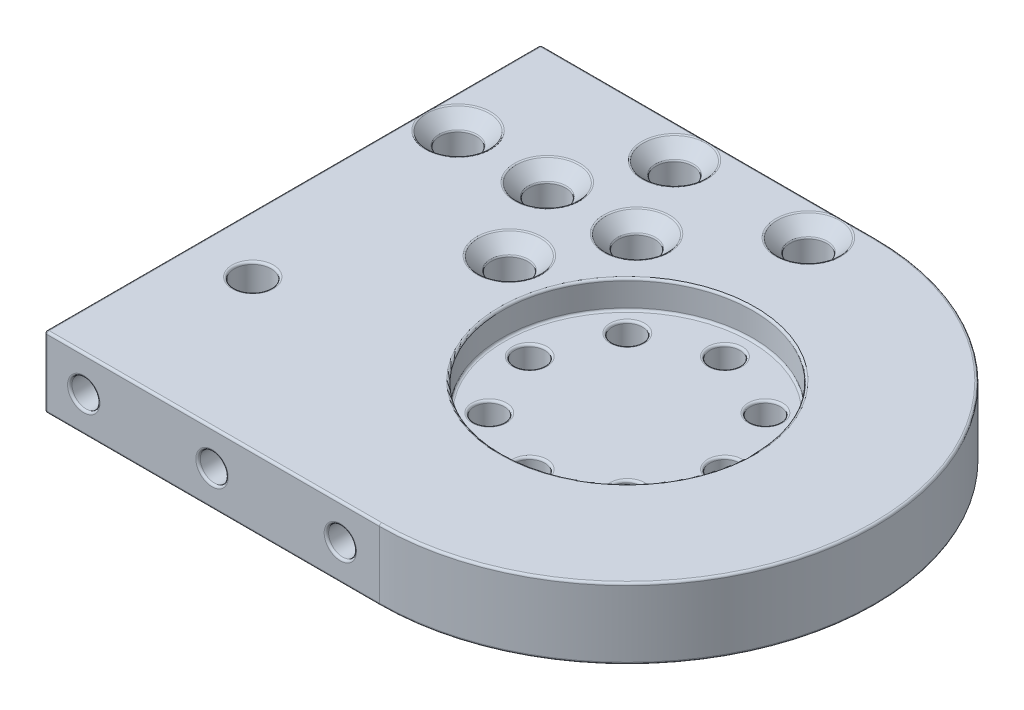
from build123d import *

# Parameters (mm, degrees)
SKETCH1_R           = 3.3
SKETCH1_R_2         = 22.5
SKETCH1_R_3         = 2.7
BOSS_EXTRUDE1_DEPTH = 12.7
CHAMFER2_SIZE       = 2.4
SKETCH1_3_R         = 22.5
CUT_EXTRUDE1_DEPTH  = 5
SKETCH2_R           = 2.5
CUT_EXTRUDE2_DEPTH  = 10
FILLET1_R           = 0.4


with BuildPart() as part:
    # Sketch1 → Boss-Extrude1 (new body)
    # profile 1 of 2: a face of its own
    with BuildSketch(Plane(origin=(0, 0, 0), x_dir=(1, 0, 0), z_dir=(0, 1, 0))):
        with BuildLine():
            Line((-60, -44.45), (0, -44.45))
            ThreePointArc((0, -44.45), (44.45, 0), (0, 44.45))
            Line((0, 44.45), (-60, 44.45))
            Line((-60, 44.45), (-60, -44.45))
        make_face()
        with Locations(Location((-49.69, -17.46, 0), (0, 0, 270))):
            Circle(SKETCH1_R, mode=Mode.SUBTRACT)
        with Locations(Location((-54, 23.65, 0), (0, 0, 270))):
            Circle(SKETCH1_R, mode=Mode.SUBTRACT)
        with Locations(Location((-6, 38.45, 0), (0, 0, 270))):
            Circle(SKETCH1_R, mode=Mode.SUBTRACT)
        with Locations(Location((-38, 23.65, 0), (0, 0, 270))):
            Circle(SKETCH1_R, mode=Mode.SUBTRACT)
        with Locations(Location((-22, 23.65, 0), (0, 0, 270))):
            Circle(SKETCH1_R, mode=Mode.SUBTRACT)
        with Locations(Location((-30, 8.85, 0), (0, 0, 270))):
            Circle(SKETCH1_R, mode=Mode.SUBTRACT)
        with Locations(Location((-30, 38.45, 0), (0, 0, 270))):
            Circle(SKETCH1_R, mode=Mode.SUBTRACT)
        Circle(SKETCH1_R_2, mode=Mode.SUBTRACT)
    # profile 2 of 2: a face of its own
    with BuildSketch(Plane(origin=(0, 0, 0), x_dir=(1, 0, 0), z_dir=(0, 1, 0))):
        Circle(SKETCH1_R_2)
        with Locations(Location((17.5, 0, 0), (0, 0, 270))):
            Circle(SKETCH1_R_3, mode=Mode.SUBTRACT)
        with Locations(Location((12.374368671, -12.374368671, 0), (0, 0, 270))):
            Circle(SKETCH1_R_3, mode=Mode.SUBTRACT)
        with Locations(Location((0, -17.5, 0), (0, 0, 270))):
            Circle(SKETCH1_R_3, mode=Mode.SUBTRACT)
        with Locations(Location((-12.374368671, -12.374368671, 0), (0, 0, 270))):
            Circle(SKETCH1_R_3, mode=Mode.SUBTRACT)
        with Locations(Location((-17.5, 0, 0), (0, 0, 270))):
            Circle(SKETCH1_R_3, mode=Mode.SUBTRACT)
        with Locations(Location((-12.374368671, 12.374368671, 0), (0, 0, 270))):
            Circle(SKETCH1_R_3, mode=Mode.SUBTRACT)
        with Locations(Location((0, 17.5, 0), (0, 0, 270))):
            Circle(SKETCH1_R_3, mode=Mode.SUBTRACT)
        with Locations(Location((12.374368671, 12.374368671, 0), (0, 0, 270))):
            Circle(SKETCH1_R_3, mode=Mode.SUBTRACT)
    extrude(amount=-BOSS_EXTRUDE1_DEPTH)

    # Chamfer2
    chamfer2_edges = [part.edges().sort_by_distance(p)[0] for p in [
        (-30, 0, -41.75),
        (-30, 0, -12.15),
        (-22, 0, -26.95),
        (-38, 0, -26.95),
        (-6, 0, -41.75),
        (-54, 0, -26.95),
    ]]
    chamfer(chamfer2_edges, length=CHAMFER2_SIZE)

    # Sketch1<3> → Cut-Extrude1 (cut)
    with BuildSketch(Plane(origin=(0, 0, 0), x_dir=(1, 0, 0), z_dir=(0, 1, 0))):
        with Locations(Location((0, 0, 0), (0, 0, 270))):
            Circle(SKETCH1_3_R)
    extrude(amount=-CUT_EXTRUDE1_DEPTH, mode=Mode.SUBTRACT)

    # Sketch2 → Cut-Extrude2 (cut)
    with BuildSketch(Plane.XY.offset(44.45)):
        with Locations((-7, -6.35)):
            Circle(SKETCH2_R)
        with Locations((-30, -6.35)):
            Circle(SKETCH2_R)
        with Locations((-53, -6.35)):
            Circle(SKETCH2_R)
    extrude(amount=-CUT_EXTRUDE2_DEPTH, mode=Mode.SUBTRACT)

    # Fillet1
    # the kernel refuses this fillet: 0.4 mm, written as the material it adds along each edge
    with BuildSketch(Plane(origin=(-7, -6.35, 34.45), x_dir=(1, 0, 0), z_dir=(0, -1, 0))) as fillet1_piece_1:
        with BuildLine():
            CenterArc((2.5 - FILLET1_R, FILLET1_R), FILLET1_R, 270, 90)
            Line((2.5 - FILLET1_R, 0), (2.5, 0))
            Line((2.5, 0), (2.5, FILLET1_R))
        make_face()
    revolve(axis=Axis((-7, -6.35, 34.45), (0, 0, 1)))
    with BuildSketch(Plane(origin=(-30, -6.35, 34.45), x_dir=(1, 0, 0), z_dir=(0, -1, 0))) as fillet1_piece_2:
        with BuildLine():
            CenterArc((2.5 - FILLET1_R, FILLET1_R), FILLET1_R, 270, 90)
            Line((2.5 - FILLET1_R, 0), (2.5, 0))
            Line((2.5, 0), (2.5, FILLET1_R))
        make_face()
    revolve(axis=Axis((-30, -6.35, 34.45), (0, 0, 1)))
    with BuildSketch(Plane(origin=(-53, -6.35, 34.45), x_dir=(1, 0, 0), z_dir=(0, -1, 0))) as fillet1_piece_3:
        with BuildLine():
            CenterArc((2.5 - FILLET1_R, FILLET1_R), FILLET1_R, 270, 90)
            Line((2.5 - FILLET1_R, 0), (2.5, 0))
            Line((2.5, 0), (2.5, FILLET1_R))
        make_face()
    revolve(axis=Axis((-53, -6.35, 34.45), (0, 0, 1)))
    with BuildSketch(Plane(origin=(0, -5, 0), x_dir=(0, 0, 1), z_dir=(-1, 0, 0))) as fillet1_piece_4:
        with BuildLine():
            CenterArc((22.5 - FILLET1_R, FILLET1_R), FILLET1_R, 270, 90)
            Line((22.5 - FILLET1_R, 0), (22.5, 0))
            Line((22.5, 0), (22.5, FILLET1_R))
        make_face()
    revolve(axis=Axis((0, -5, 0), (0, 1, 0)))
    # the kernel refuses this fillet: 0.4 mm, written as the material it takes off along each edge
    with BuildSketch(Plane(origin=(-59.6, -0.4, -44.05), x_dir=(0, 0, -1), z_dir=(0, 1, 0))) as fillet1_2_piece_1_section:
        Polygon((0, 0), (FILLET1_R, 0), (FILLET1_R, FILLET1_R), (0, FILLET1_R), align=None)
    fillet1_2_piece_1 = extrude(amount=FILLET1_R, mode=Mode.PRIVATE)
    fillet1_2_piece_1 = fillet1_2_piece_1 - Plane(origin=(-59.6, -0.4, -44.05), x_dir=(0.7071067811865475, 0, 0.7071067811865475), z_dir=(0, 1, 0)) * Sphere(FILLET1_R, mode=Mode.PRIVATE)
    add(fillet1_2_piece_1, mode=Mode.SUBTRACT)
    with BuildSketch(Plane(origin=(-59.6, -0.4, 44.05), x_dir=(-1, 0, 0), z_dir=(0, 1, 0))) as fillet1_2_piece_2_section:
        Polygon((0, 0), (FILLET1_R, 0), (FILLET1_R, FILLET1_R), (0, FILLET1_R), align=None)
    fillet1_2_piece_2 = extrude(amount=FILLET1_R, mode=Mode.PRIVATE)
    fillet1_2_piece_2 = fillet1_2_piece_2 - Plane(origin=(-59.6, -0.4, 44.05), x_dir=(0.7071067811865475, 0, -0.7071067811865475), z_dir=(0, 1, 0)) * Sphere(FILLET1_R, mode=Mode.PRIVATE)
    add(fillet1_2_piece_2, mode=Mode.SUBTRACT)
    with BuildSketch(Plane(origin=(-59.6, -12.3, 44.05), x_dir=(0, 0, 1), z_dir=(-1, 0, 0))) as fillet1_2_piece_3_section:
        Polygon((0, 0), (FILLET1_R, 0), (FILLET1_R, -FILLET1_R), (0, -FILLET1_R), align=None)
    fillet1_2_piece_3 = extrude(amount=FILLET1_R, mode=Mode.PRIVATE)
    fillet1_2_piece_3 = fillet1_2_piece_3 - Plane(origin=(-59.6, -12.3, 44.05), x_dir=(0, 0.7071067811865475, -0.7071067811865475), z_dir=(-1, 0, 0)) * Sphere(FILLET1_R, mode=Mode.PRIVATE)
    add(fillet1_2_piece_3, mode=Mode.SUBTRACT)
    with BuildSketch(Plane(origin=(-59.6, -12.3, -44.05), x_dir=(-1, 0, 0), z_dir=(0, 0, -1))) as fillet1_2_piece_4_section:
        Polygon((0, 0), (FILLET1_R, 0), (FILLET1_R, -FILLET1_R), (0, -FILLET1_R), align=None)
    fillet1_2_piece_4 = extrude(amount=FILLET1_R, mode=Mode.PRIVATE)
    fillet1_2_piece_4 = fillet1_2_piece_4 - Plane(origin=(-59.6, -12.3, -44.05), x_dir=(0.7071067811865475, 0.7071067811865475, 0), z_dir=(0, 0, -1)) * Sphere(FILLET1_R, mode=Mode.PRIVATE)
    add(fillet1_2_piece_4, mode=Mode.SUBTRACT)
    with BuildSketch(Plane(origin=(-7, -6.35, 44.45), x_dir=(1, 0, 0), z_dir=(0, -1, 0))) as fillet1_2_piece_5:
        with BuildLine():
            CenterArc((2.5 + FILLET1_R, -FILLET1_R), FILLET1_R, 90, 90)
            Line((2.5, -FILLET1_R), (2.5, 0))
            Line((2.5, 0), (2.5 + FILLET1_R, 0))
        make_face()
    revolve(axis=Axis((-7, -6.35, 44.45), (0, 0, 1)), mode=Mode.SUBTRACT)
    with BuildSketch(Plane(origin=(-30, -6.35, 44.45), x_dir=(1, 0, 0), z_dir=(0, -1, 0))) as fillet1_2_piece_6:
        with BuildLine():
            CenterArc((2.5 + FILLET1_R, -FILLET1_R), FILLET1_R, 90, 90)
            Line((2.5, -FILLET1_R), (2.5, 0))
            Line((2.5, 0), (2.5 + FILLET1_R, 0))
        make_face()
    revolve(axis=Axis((-30, -6.35, 44.45), (0, 0, 1)), mode=Mode.SUBTRACT)
    with BuildSketch(Plane(origin=(-53, -6.35, 44.45), x_dir=(1, 0, 0), z_dir=(0, -1, 0))) as fillet1_2_piece_7:
        with BuildLine():
            CenterArc((2.5 + FILLET1_R, -FILLET1_R), FILLET1_R, 90, 90)
            Line((2.5, -FILLET1_R), (2.5, 0))
            Line((2.5, 0), (2.5 + FILLET1_R, 0))
        make_face()
    revolve(axis=Axis((-53, -6.35, 44.45), (0, 0, 1)), mode=Mode.SUBTRACT)
    with BuildSketch(Plane(origin=(-49.69, -12.7, 17.46), x_dir=(0, 0, 1), z_dir=(-1, 0, 0))) as fillet1_2_piece_8:
        with BuildLine():
            CenterArc((3.3 + FILLET1_R, FILLET1_R), FILLET1_R, 180, 90)
            Line((3.3 + FILLET1_R, 0), (3.3, 0))
            Line((3.3, 0), (3.3, FILLET1_R))
        make_face()
    revolve(axis=Axis((-49.69, -12.7, 17.46), (0, 1, 0)), mode=Mode.SUBTRACT)
    with BuildSketch(Plane(origin=(-54, -12.7, -23.65), x_dir=(0, 0, 1), z_dir=(-1, 0, 0))) as fillet1_2_piece_9:
        with BuildLine():
            CenterArc((3.3 + FILLET1_R, FILLET1_R), FILLET1_R, 180, 90)
            Line((3.3, FILLET1_R), (3.3, 0))
            Line((3.3, 0), (3.3 + FILLET1_R, 0))
        make_face()
    revolve(axis=Axis((-54, -12.7, -23.65), (0, 1, 0)), mode=Mode.SUBTRACT)
    with BuildSketch(Plane(origin=(-60, 0, -44.05), x_dir=(1, 0, 0), z_dir=(0, 0, 1)), Plane(origin=(-60, -12.7, -44.05), x_dir=(0, 1, 0), z_dir=(0, 0, 1))) as fillet1_2_piece_10:
        with BuildLine():
            CenterArc((FILLET1_R, -FILLET1_R), FILLET1_R, 90, 90)
            Line((0, -FILLET1_R), (0, 0))
            Line((0, 0), (FILLET1_R, 0))
        make_face()
    extrude(amount=88.1, mode=Mode.SUBTRACT)
    with BuildSketch(Plane(origin=(0, 0, -44.45), x_dir=(0, 0, 1), z_dir=(-1, 0, 0)), Plane(origin=(-59.6, 0, 44.45), x_dir=(0, 0, -1), z_dir=(1, 0, 0)), Plane(origin=(-59.6, -12.7, 44.45), x_dir=(0, 1, 0), z_dir=(1, 0, 0)), Plane(origin=(0, -12.7, -44.45), x_dir=(0, 1, 0), z_dir=(-1, 0, 0))) as fillet1_2_piece_11:
        with BuildLine():
            CenterArc((FILLET1_R, -FILLET1_R), FILLET1_R, 90, 90)
            Line((0, -FILLET1_R), (0, 0))
            Line((0, 0), (FILLET1_R, 0))
        make_face()
    extrude(amount=59.6, mode=Mode.SUBTRACT)
    with BuildSketch(Plane(origin=(0, 0, 0), x_dir=(0, 0, 1), z_dir=(-1, 0, 0))) as fillet1_2_piece_12:
        with BuildLine():
            CenterArc((44.45 - FILLET1_R, -FILLET1_R), FILLET1_R, 0, 90)
            Line((44.45, -FILLET1_R), (44.45, 0))
            Line((44.45, 0), (44.45 - FILLET1_R, 0))
        make_face()
    revolve(axis=Axis((0, 0, 0), (0, 1, 0)), revolution_arc=180, mode=Mode.SUBTRACT)
    with BuildSketch(Plane(origin=(-6, -12.7, -38.45), x_dir=(0, 0, 1), z_dir=(-1, 0, 0))) as fillet1_2_piece_13:
        with BuildLine():
            CenterArc((3.3 + FILLET1_R, FILLET1_R), FILLET1_R, 180, 90)
            Line((3.3, FILLET1_R), (3.3, 0))
            Line((3.3, 0), (3.3 + FILLET1_R, 0))
        make_face()
    revolve(axis=Axis((-6, -12.7, -38.45), (0, 1, 0)), mode=Mode.SUBTRACT)
    with BuildSketch(Plane(origin=(-49.69, 0, 17.46), x_dir=(0, 0, 1), z_dir=(-1, 0, 0))) as fillet1_2_piece_14:
        with BuildLine():
            CenterArc((3.3 + FILLET1_R, -FILLET1_R), FILLET1_R, 90, 90)
            Line((3.3, -FILLET1_R), (3.3, 0))
            Line((3.3, 0), (3.3 + FILLET1_R, 0))
        make_face()
    revolve(axis=Axis((-49.69, 0, 17.46), (0, 1, 0)), mode=Mode.SUBTRACT)
    with BuildSketch(Plane(origin=(-38, -12.7, -23.65), x_dir=(0, 0, 1), z_dir=(-1, 0, 0))) as fillet1_2_piece_15:
        with BuildLine():
            CenterArc((3.3 + FILLET1_R, FILLET1_R), FILLET1_R, 180, 90)
            Line((3.3, FILLET1_R), (3.3, 0))
            Line((3.3, 0), (3.3 + FILLET1_R, 0))
        make_face()
    revolve(axis=Axis((-38, -12.7, -23.65), (0, 1, 0)), mode=Mode.SUBTRACT)
    with BuildSketch(Plane(origin=(-60, -0.4, 44.45), x_dir=(0, 0, -1), z_dir=(0, -1, 0)), Plane(origin=(-60, -0.4, -44.45), x_dir=(1, 0, 0), z_dir=(0, -1, 0))) as fillet1_2_piece_16:
        with BuildLine():
            CenterArc((FILLET1_R, FILLET1_R), FILLET1_R, 180, 90)
            Line((0, FILLET1_R), (0, 0))
            Line((0, 0), (FILLET1_R, 0))
        make_face()
    extrude(amount=11.9, mode=Mode.SUBTRACT)
    with BuildSketch(Plane(origin=(-22, -12.7, -23.65), x_dir=(0, 0, 1), z_dir=(-1, 0, 0))) as fillet1_2_piece_17:
        with BuildLine():
            CenterArc((3.3 + FILLET1_R, FILLET1_R), FILLET1_R, 180, 90)
            Line((3.3, FILLET1_R), (3.3, 0))
            Line((3.3, 0), (3.3 + FILLET1_R, 0))
        make_face()
    revolve(axis=Axis((-22, -12.7, -23.65), (0, 1, 0)), mode=Mode.SUBTRACT)
    with BuildSketch(Plane(origin=(-30, -12.7, -8.85), x_dir=(0, 0, 1), z_dir=(-1, 0, 0))) as fillet1_2_piece_18:
        with BuildLine():
            CenterArc((3.3 + FILLET1_R, FILLET1_R), FILLET1_R, 180, 90)
            Line((3.3, FILLET1_R), (3.3, 0))
            Line((3.3, 0), (3.3 + FILLET1_R, 0))
        make_face()
    revolve(axis=Axis((-30, -12.7, -8.85), (0, 1, 0)), mode=Mode.SUBTRACT)
    with BuildSketch(Plane(origin=(-30, -12.7, -38.45), x_dir=(0, 0, 1), z_dir=(-1, 0, 0))) as fillet1_2_piece_19:
        with BuildLine():
            CenterArc((3.3 + FILLET1_R, FILLET1_R), FILLET1_R, 180, 90)
            Line((3.3, FILLET1_R), (3.3, 0))
            Line((3.3, 0), (3.3 + FILLET1_R, 0))
        make_face()
    revolve(axis=Axis((-30, -12.7, -38.45), (0, 1, 0)), mode=Mode.SUBTRACT)
    with BuildSketch(Plane(origin=(0, -12.7, 0), x_dir=(0, 0, 1), z_dir=(-1, 0, 0))) as fillet1_2_piece_20:
        with BuildLine():
            CenterArc((44.45 - FILLET1_R, FILLET1_R), FILLET1_R, 270, 90)
            Line((44.45 - FILLET1_R, 0), (44.45, 0))
            Line((44.45, 0), (44.45, FILLET1_R))
        make_face()
    revolve(axis=Axis((0, -12.7, 0), (0, 1, 0)), revolution_arc=180, mode=Mode.SUBTRACT)
    with BuildSketch(Plane(origin=(-6, -2.4, -38.45), x_dir=(0, 0, 1), z_dir=(-1, 0, 0))) as fillet1_2_piece_21:
        with BuildLine():
            CenterArc((3.3 + FILLET1_R, -FILLET1_R * 0.414213562373), FILLET1_R, 135, 45)
            Line((3.3, -FILLET1_R * 0.414213562373), (3.3, 0))
            Line((3.3, 0), (3.3 + FILLET1_R * 0.292893218813, FILLET1_R * 0.292893218813))
        make_face()
    revolve(axis=Axis((-6, -2.4, -38.45), (0, 1, 0)), mode=Mode.SUBTRACT)
    with BuildSketch(Plane(origin=(-54, 0, -23.65), x_dir=(0, 0, 1), z_dir=(-1, 0, 0))) as fillet1_2_piece_22:
        with BuildLine():
            CenterArc((5.7 + FILLET1_R * 0.414213562373, -FILLET1_R), FILLET1_R, 90, 45)
            Line((5.7 - FILLET1_R * 0.292893218813, -FILLET1_R * 0.292893218813), (5.7, 0))
            Line((5.7, 0), (5.7 + FILLET1_R * 0.414213562373, 0))
        make_face()
    revolve(axis=Axis((-54, 0, -23.65), (0, 1, 0)), mode=Mode.SUBTRACT)
    with BuildSketch(Plane(origin=(-38, 0, -23.65), x_dir=(0, 0, 1), z_dir=(-1, 0, 0))) as fillet1_2_piece_23:
        with BuildLine():
            CenterArc((5.7 + FILLET1_R * 0.414213562373, -FILLET1_R), FILLET1_R, 90, 45)
            Line((5.7 - FILLET1_R * 0.292893218813, -FILLET1_R * 0.292893218813), (5.7, 0))
            Line((5.7, 0), (5.7 + FILLET1_R * 0.414213562373, 0))
        make_face()
    revolve(axis=Axis((-38, 0, -23.65), (0, 1, 0)), mode=Mode.SUBTRACT)
    with BuildSketch(Plane(origin=(-30, 0, -38.45), x_dir=(0, 0, 1), z_dir=(-1, 0, 0))) as fillet1_2_piece_24:
        with BuildLine():
            CenterArc((5.7 + FILLET1_R * 0.414213562373, -FILLET1_R), FILLET1_R, 90, 45)
            Line((5.7 - FILLET1_R * 0.292893218813, -FILLET1_R * 0.292893218813), (5.7, 0))
            Line((5.7, 0), (5.7 + FILLET1_R * 0.414213562373, 0))
        make_face()
    revolve(axis=Axis((-30, 0, -38.45), (0, 1, 0)), mode=Mode.SUBTRACT)
    with BuildSketch(Plane(origin=(-22, 0, -23.65), x_dir=(0, 0, 1), z_dir=(-1, 0, 0))) as fillet1_2_piece_25:
        with BuildLine():
            CenterArc((5.7 + FILLET1_R * 0.414213562373, -FILLET1_R), FILLET1_R, 90, 45)
            Line((5.7 - FILLET1_R * 0.292893218813, -FILLET1_R * 0.292893218813), (5.7, 0))
            Line((5.7, 0), (5.7 + FILLET1_R * 0.414213562373, 0))
        make_face()
    revolve(axis=Axis((-22, 0, -23.65), (0, 1, 0)), mode=Mode.SUBTRACT)
    with BuildSketch(Plane(origin=(-30, 0, -8.85), x_dir=(0, 0, 1), z_dir=(-1, 0, 0))) as fillet1_2_piece_26:
        with BuildLine():
            CenterArc((5.7 + FILLET1_R * 0.414213562373, -FILLET1_R), FILLET1_R, 90, 45)
            Line((5.7 - FILLET1_R * 0.292893218813, -FILLET1_R * 0.292893218813), (5.7, 0))
            Line((5.7, 0), (5.7 + FILLET1_R * 0.414213562373, 0))
        make_face()
    revolve(axis=Axis((-30, 0, -8.85), (0, 1, 0)), mode=Mode.SUBTRACT)
    with BuildSketch(Plane(origin=(-6, 0, -38.45), x_dir=(0, 0, 1), z_dir=(-1, 0, 0))) as fillet1_2_piece_27:
        with BuildLine():
            CenterArc((5.7 + FILLET1_R * 0.414213562373, -FILLET1_R), FILLET1_R, 90, 45)
            Line((5.7 - FILLET1_R * 0.292893218813, -FILLET1_R * 0.292893218813), (5.7, 0))
            Line((5.7, 0), (5.7 + FILLET1_R * 0.414213562373, 0))
        make_face()
    revolve(axis=Axis((-6, 0, -38.45), (0, 1, 0)), mode=Mode.SUBTRACT)
    with BuildSketch(Plane(origin=(-30, -2.4, -8.85), x_dir=(0, 0, 1), z_dir=(-1, 0, 0))) as fillet1_2_piece_28:
        with BuildLine():
            CenterArc((3.3 + FILLET1_R, -FILLET1_R * 0.414213562373), FILLET1_R, 135, 45)
            Line((3.3, -FILLET1_R * 0.414213562373), (3.3, 0))
            Line((3.3, 0), (3.3 + FILLET1_R * 0.292893218813, FILLET1_R * 0.292893218813))
        make_face()
    revolve(axis=Axis((-30, -2.4, -8.85), (0, 1, 0)), mode=Mode.SUBTRACT)
    with BuildSketch(Plane(origin=(-22, -2.4, -23.65), x_dir=(0, 0, 1), z_dir=(-1, 0, 0))) as fillet1_2_piece_29:
        with BuildLine():
            CenterArc((3.3 + FILLET1_R, -FILLET1_R * 0.414213562373), FILLET1_R, 135, 45)
            Line((3.3, -FILLET1_R * 0.414213562373), (3.3, 0))
            Line((3.3, 0), (3.3 + FILLET1_R * 0.292893218813, FILLET1_R * 0.292893218813))
        make_face()
    revolve(axis=Axis((-22, -2.4, -23.65), (0, 1, 0)), mode=Mode.SUBTRACT)
    with BuildSketch(Plane(origin=(-30, -2.4, -38.45), x_dir=(0, 0, 1), z_dir=(-1, 0, 0))) as fillet1_2_piece_30:
        with BuildLine():
            CenterArc((3.3 + FILLET1_R, -FILLET1_R * 0.414213562373), FILLET1_R, 135, 45)
            Line((3.3, -FILLET1_R * 0.414213562373), (3.3, 0))
            Line((3.3, 0), (3.3 + FILLET1_R * 0.292893218813, FILLET1_R * 0.292893218813))
        make_face()
    revolve(axis=Axis((-30, -2.4, -38.45), (0, 1, 0)), mode=Mode.SUBTRACT)
    with BuildSketch(Plane(origin=(-38, -2.4, -23.65), x_dir=(0, 0, 1), z_dir=(-1, 0, 0))) as fillet1_2_piece_31:
        with BuildLine():
            CenterArc((3.3 + FILLET1_R, -FILLET1_R * 0.414213562373), FILLET1_R, 135, 45)
            Line((3.3, -FILLET1_R * 0.414213562373), (3.3, 0))
            Line((3.3, 0), (3.3 + FILLET1_R * 0.292893218813, FILLET1_R * 0.292893218813))
        make_face()
    revolve(axis=Axis((-38, -2.4, -23.65), (0, 1, 0)), mode=Mode.SUBTRACT)
    with BuildSketch(Plane(origin=(-54, -2.4, -23.65), x_dir=(0, 0, 1), z_dir=(-1, 0, 0))) as fillet1_2_piece_32:
        with BuildLine():
            CenterArc((3.3 + FILLET1_R, -FILLET1_R * 0.414213562373), FILLET1_R, 135, 45)
            Line((3.3, -FILLET1_R * 0.414213562373), (3.3, 0))
            Line((3.3, 0), (3.3 + FILLET1_R * 0.292893218813, FILLET1_R * 0.292893218813))
        make_face()
    revolve(axis=Axis((-54, -2.4, -23.65), (0, 1, 0)), mode=Mode.SUBTRACT)
    with BuildSketch(Plane(origin=(17.5, -12.7, 0), x_dir=(0, 0, 1), z_dir=(-1, 0, 0))) as fillet1_2_piece_33:
        with BuildLine():
            CenterArc((2.7 + FILLET1_R, FILLET1_R), FILLET1_R, 180, 90)
            Line((2.7, FILLET1_R), (2.7, 0))
            Line((2.7, 0), (2.7 + FILLET1_R, 0))
        make_face()
    revolve(axis=Axis((17.5, -12.7, 0), (0, 1, 0)), mode=Mode.SUBTRACT)
    with BuildSketch(Plane(origin=(12.374368671, -12.7, 12.374368671), x_dir=(0, 0, 1), z_dir=(-1, 0, 0))) as fillet1_2_piece_34:
        with BuildLine():
            CenterArc((2.7 + FILLET1_R, FILLET1_R), FILLET1_R, 180, 90)
            Line((2.7, FILLET1_R), (2.7, 0))
            Line((2.7, 0), (2.7 + FILLET1_R, 0))
        make_face()
    revolve(axis=Axis((12.374368671, -12.7, 12.374368671), (0, 1, 0)), mode=Mode.SUBTRACT)
    with BuildSketch(Plane(origin=(0, -12.7, 17.5), x_dir=(0, 0, 1), z_dir=(-1, 0, 0))) as fillet1_2_piece_35:
        with BuildLine():
            CenterArc((2.7 + FILLET1_R, FILLET1_R), FILLET1_R, 180, 90)
            Line((2.7, FILLET1_R), (2.7, 0))
            Line((2.7, 0), (2.7 + FILLET1_R, 0))
        make_face()
    revolve(axis=Axis((0, -12.7, 17.5), (0, 1, 0)), mode=Mode.SUBTRACT)
    with BuildSketch(Plane(origin=(-12.374368671, -12.7, 12.374368671), x_dir=(0, 0, 1), z_dir=(-1, 0, 0))) as fillet1_2_piece_36:
        with BuildLine():
            CenterArc((2.7 + FILLET1_R, FILLET1_R), FILLET1_R, 180, 90)
            Line((2.7, FILLET1_R), (2.7, 0))
            Line((2.7, 0), (2.7 + FILLET1_R, 0))
        make_face()
    revolve(axis=Axis((-12.374368671, -12.7, 12.374368671), (0, 1, 0)), mode=Mode.SUBTRACT)
    with BuildSketch(Plane(origin=(-17.5, -12.7, 0), x_dir=(0, 0, 1), z_dir=(-1, 0, 0))) as fillet1_2_piece_37:
        with BuildLine():
            CenterArc((2.7 + FILLET1_R, FILLET1_R), FILLET1_R, 180, 90)
            Line((2.7, FILLET1_R), (2.7, 0))
            Line((2.7, 0), (2.7 + FILLET1_R, 0))
        make_face()
    revolve(axis=Axis((-17.5, -12.7, 0), (0, 1, 0)), mode=Mode.SUBTRACT)
    with BuildSketch(Plane(origin=(0, -5, -17.5), x_dir=(0, 0, 1), z_dir=(-1, 0, 0))) as fillet1_2_piece_38:
        with BuildLine():
            CenterArc((2.7 + FILLET1_R, -FILLET1_R), FILLET1_R, 90, 90)
            Line((2.7 + FILLET1_R, 0), (2.7, 0))
            Line((2.7, 0), (2.7, -FILLET1_R))
        make_face()
    revolve(axis=Axis((0, -5, -17.5), (0, 1, 0)), mode=Mode.SUBTRACT)
    with BuildSketch(Plane(origin=(-12.374368671, -5, -12.374368671), x_dir=(0, 0, 1), z_dir=(-1, 0, 0))) as fillet1_2_piece_39:
        with BuildLine():
            CenterArc((2.7 + FILLET1_R, -FILLET1_R), FILLET1_R, 90, 90)
            Line((2.7 + FILLET1_R, 0), (2.7, 0))
            Line((2.7, 0), (2.7, -FILLET1_R))
        make_face()
    revolve(axis=Axis((-12.374368671, -5, -12.374368671), (0, 1, 0)), mode=Mode.SUBTRACT)
    with BuildSketch(Plane(origin=(-17.5, -5, 0), x_dir=(0, 0, 1), z_dir=(-1, 0, 0))) as fillet1_2_piece_40:
        with BuildLine():
            CenterArc((2.7 + FILLET1_R, -FILLET1_R), FILLET1_R, 90, 90)
            Line((2.7 + FILLET1_R, 0), (2.7, 0))
            Line((2.7, 0), (2.7, -FILLET1_R))
        make_face()
    revolve(axis=Axis((-17.5, -5, 0), (0, 1, 0)), mode=Mode.SUBTRACT)
    with BuildSketch(Plane(origin=(-12.374368671, -5, 12.374368671), x_dir=(0, 0, 1), z_dir=(-1, 0, 0))) as fillet1_2_piece_41:
        with BuildLine():
            CenterArc((2.7 + FILLET1_R, -FILLET1_R), FILLET1_R, 90, 90)
            Line((2.7 + FILLET1_R, 0), (2.7, 0))
            Line((2.7, 0), (2.7, -FILLET1_R))
        make_face()
    revolve(axis=Axis((-12.374368671, -5, 12.374368671), (0, 1, 0)), mode=Mode.SUBTRACT)
    with BuildSketch(Plane(origin=(0, -5, 17.5), x_dir=(0, 0, 1), z_dir=(-1, 0, 0))) as fillet1_2_piece_42:
        with BuildLine():
            CenterArc((2.7 + FILLET1_R, -FILLET1_R), FILLET1_R, 90, 90)
            Line((2.7 + FILLET1_R, 0), (2.7, 0))
            Line((2.7, 0), (2.7, -FILLET1_R))
        make_face()
    revolve(axis=Axis((0, -5, 17.5), (0, 1, 0)), mode=Mode.SUBTRACT)
    with BuildSketch(Plane(origin=(12.374368671, -5, 12.374368671), x_dir=(0, 0, 1), z_dir=(-1, 0, 0))) as fillet1_2_piece_43:
        with BuildLine():
            CenterArc((2.7 + FILLET1_R, -FILLET1_R), FILLET1_R, 90, 90)
            Line((2.7 + FILLET1_R, 0), (2.7, 0))
            Line((2.7, 0), (2.7, -FILLET1_R))
        make_face()
    revolve(axis=Axis((12.374368671, -5, 12.374368671), (0, 1, 0)), mode=Mode.SUBTRACT)
    with BuildSketch(Plane(origin=(17.5, -5, 0), x_dir=(0, 0, 1), z_dir=(-1, 0, 0))) as fillet1_2_piece_44:
        with BuildLine():
            CenterArc((2.7 + FILLET1_R, -FILLET1_R), FILLET1_R, 90, 90)
            Line((2.7 + FILLET1_R, 0), (2.7, 0))
            Line((2.7, 0), (2.7, -FILLET1_R))
        make_face()
    revolve(axis=Axis((17.5, -5, 0), (0, 1, 0)), mode=Mode.SUBTRACT)
    with BuildSketch(Plane(origin=(0, 0, 0), x_dir=(0, 0, 1), z_dir=(-1, 0, 0))) as fillet1_2_piece_45:
        with BuildLine():
            CenterArc((22.5 + FILLET1_R, -FILLET1_R), FILLET1_R, 90, 90)
            Line((22.5, -FILLET1_R), (22.5, 0))
            Line((22.5, 0), (22.5 + FILLET1_R, 0))
        make_face()
    revolve(axis=Axis((0, 0, 0), (0, 1, 0)), mode=Mode.SUBTRACT)
    with BuildSketch(Plane(origin=(12.374368671, -5, -12.374368671), x_dir=(0, 0, 1), z_dir=(-1, 0, 0))) as fillet1_2_piece_46:
        with BuildLine():
            CenterArc((2.7 + FILLET1_R, -FILLET1_R), FILLET1_R, 90, 90)
            Line((2.7 + FILLET1_R, 0), (2.7, 0))
            Line((2.7, 0), (2.7, -FILLET1_R))
        make_face()
    revolve(axis=Axis((12.374368671, -5, -12.374368671), (0, 1, 0)), mode=Mode.SUBTRACT)
    with BuildSketch(Plane(origin=(-12.374368671, -12.7, -12.374368671), x_dir=(0, 0, 1), z_dir=(-1, 0, 0))) as fillet1_2_piece_47:
        with BuildLine():
            CenterArc((2.7 + FILLET1_R, FILLET1_R), FILLET1_R, 180, 90)
            Line((2.7, FILLET1_R), (2.7, 0))
            Line((2.7, 0), (2.7 + FILLET1_R, 0))
        make_face()
    revolve(axis=Axis((-12.374368671, -12.7, -12.374368671), (0, 1, 0)), mode=Mode.SUBTRACT)
    with BuildSketch(Plane(origin=(0, -12.7, -17.5), x_dir=(0, 0, 1), z_dir=(-1, 0, 0))) as fillet1_2_piece_48:
        with BuildLine():
            CenterArc((2.7 + FILLET1_R, FILLET1_R), FILLET1_R, 180, 90)
            Line((2.7, FILLET1_R), (2.7, 0))
            Line((2.7, 0), (2.7 + FILLET1_R, 0))
        make_face()
    revolve(axis=Axis((0, -12.7, -17.5), (0, 1, 0)), mode=Mode.SUBTRACT)
    with BuildSketch(Plane(origin=(12.374368671, -12.7, -12.374368671), x_dir=(0, 0, 1), z_dir=(-1, 0, 0))) as fillet1_2_piece_49:
        with BuildLine():
            CenterArc((2.7 + FILLET1_R, FILLET1_R), FILLET1_R, 180, 90)
            Line((2.7, FILLET1_R), (2.7, 0))
            Line((2.7, 0), (2.7 + FILLET1_R, 0))
        make_face()
    revolve(axis=Axis((12.374368671, -12.7, -12.374368671), (0, 1, 0)), mode=Mode.SUBTRACT)


solid = part.part
